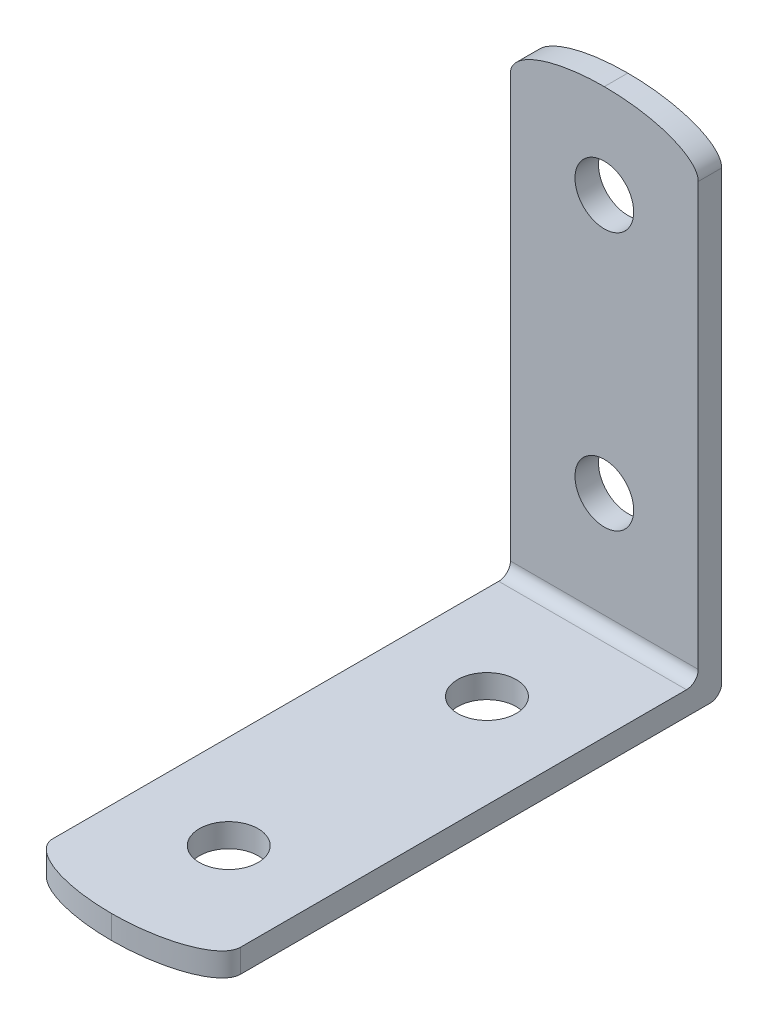
from build123d import *

# Parameters (mm, degrees)
ESQUISSE1_R             = 2.5
BOSS_EXTRU_1_DEPTH      = 2
ESQUISSE2_W             = 16
ESQUISSE2_H             = 2
BOSS_EXTRU_2_DEPTH      = 42
CONG_1_R                = 1
ENL_V_MAT_EXTRU_1_REACH = 63.351
ESQUISSE3_R             = 2.5
CONG_2_SIZE             = 3
CONG_2_SIZE_2           = 8
CONG_3_SIZE             = 3
CONG_3_SIZE_2           = 8


with BuildPart() as part:
    # Esquisse1 → Boss.-Extru.1 (new body)
    with BuildSketch(Plane.XY):
        Polygon((0, 0), (8, 0), (8, 42), (-8, 42), (-8, 0), align=None)
        with Locations((0, 12)):
            Circle(ESQUISSE1_R, mode=Mode.SUBTRACT)
        with Locations((0, 34)):
            Circle(ESQUISSE1_R, mode=Mode.SUBTRACT)
    extrude(amount=BOSS_EXTRU_1_DEPTH)

    # Esquisse2 → Boss.-Extru.2 (add)
    with BuildSketch(Plane.XY.offset(2)):
        with Locations((0, 1)):
            Rectangle(ESQUISSE2_W, ESQUISSE2_H)
    extrude(amount=BOSS_EXTRU_2_DEPTH)

    # Congé1
    cong_1_edges = [part.edges().sort_by_distance(p)[0] for p in [
        (0, 2, 2),
        (0, 0, 0),
    ]]
    fillet(cong_1_edges, radius=CONG_1_R)

    # Esquisse3 → Enlèv. mat.-Extru.1 (cut, up to next)
    with BuildSketch(Plane.XZ, mode=Mode.PRIVATE) as enl_v_mat_extru_1_sk1:
        with Locations(Location((0, 12, 0), (0, 0, 270))):
            Circle(ESQUISSE3_R)
    enl_v_mat_extru_1_tool1 = extrude(enl_v_mat_extru_1_sk1.sketch, amount=-ENL_V_MAT_EXTRU_1_REACH, mode=Mode.PRIVATE) & part.part
    # Esquisse3 → Enlèv. mat.-Extru.1 (cut, up to next)
    with BuildSketch(Plane.XZ, mode=Mode.PRIVATE) as enl_v_mat_extru_1_sk2:
        with Locations(Location((0, 34, 0), (0, 0, 270))):
            Circle(ESQUISSE3_R)
    enl_v_mat_extru_1_tool2 = extrude(enl_v_mat_extru_1_sk2.sketch, amount=-ENL_V_MAT_EXTRU_1_REACH, mode=Mode.PRIVATE) & part.part
    add(enl_v_mat_extru_1_tool1.solids().sort_by_distance((0, 0, 12))[0], mode=Mode.SUBTRACT)
    add(enl_v_mat_extru_1_tool2.solids().sort_by_distance((0, 0, 34))[0], mode=Mode.SUBTRACT)

    # Congé2
    # an asymmetric fillet: 8, 3 mm, written as the material it takes off along each edge
    with BuildSketch(Plane(origin=(8, 42, -20), x_dir=(0, -1, 0), z_dir=(0, 0, 1))) as cong_2_piece_1:
        with BuildLine():
            Bezier((CONG_2_SIZE, 0), (0, 0), (0, -CONG_2_SIZE_2), weights=[1, 0.707106781, 1])
            Line((0, -CONG_2_SIZE_2), (0, 0))
            Line((0, 0), (CONG_2_SIZE, 0))
        make_face()
    extrude(amount=42, mode=Mode.SUBTRACT)
    with BuildSketch(Plane(origin=(-8, 22, 44), x_dir=(1, 0, 0), z_dir=(0, -1, 0))) as cong_2_piece_2:
        with BuildLine():
            Bezier((CONG_2_SIZE_2, 0), (0, 0), (0, -CONG_2_SIZE), weights=[1, 0.707106781, 1])
            Line((0, -CONG_2_SIZE), (0, 0))
            Line((0, 0), (CONG_2_SIZE_2, 0))
        make_face()
    extrude(amount=42, mode=Mode.SUBTRACT)
    with BuildSketch(Plane(origin=(8, -20, 44), x_dir=(0, 0, -1), z_dir=(0, 1, 0))) as cong_2_piece_3:
        with BuildLine():
            Bezier((CONG_2_SIZE, 0), (0, 0), (0, CONG_2_SIZE_2), weights=[1, 0.707106781, 1])
            Line((0, CONG_2_SIZE_2), (0, 0))
            Line((0, 0), (CONG_2_SIZE, 0))
        make_face()
    extrude(amount=42, mode=Mode.SUBTRACT)

    # Congé3
    # an asymmetric fillet: 8, 3 mm, written as the material it takes off along each edge
    with BuildSketch(Plane(origin=(-8, 42, -20), x_dir=(0, -1, 0), z_dir=(0, 0, 1))) as cong_3_piece_1:
        with BuildLine():
            Bezier((CONG_3_SIZE, 0), (0, 0), (0, CONG_3_SIZE_2), weights=[1, 0.707106781, 1])
            Line((0, CONG_3_SIZE_2), (0, 0))
            Line((0, 0), (CONG_3_SIZE, 0))
        make_face()
    extrude(amount=42, mode=Mode.SUBTRACT)


solid = part.part
